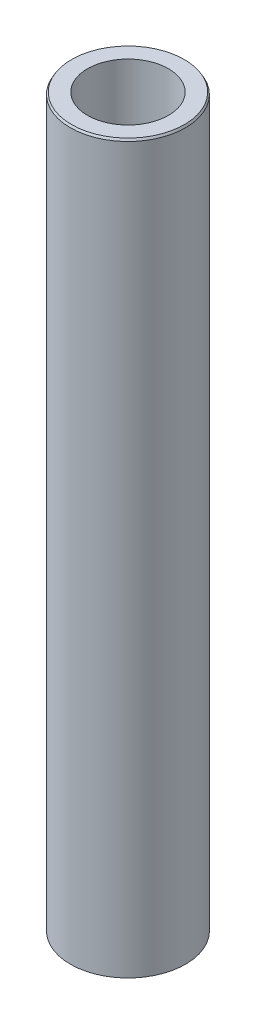
from build123d import *
from OCP.BRepFilletAPI import BRepFilletAPI_MakeChamfer

# Parameters (mm, degrees)
SKETCH1_R           = 47.5
BOSS_EXTRUDE1_DEPTH = 600
SKETCH2_R           = 33.361640255
CUT_EXTRUDE1_DEPTH  = 604.748706003
CHAMFER1_SIZE       = 1.738535662
CHAMFER1_SIZE2      = 1.003744033


with BuildPart() as part:
    # Sketch1 → Boss-Extrude1 (new body)
    with BuildSketch(Plane(origin=(0, 0, 0), x_dir=(1, 0, 0), z_dir=(0, 1, 0))):
        Circle(SKETCH1_R)
    extrude(amount=BOSS_EXTRUDE1_DEPTH)

    # Sketch2 → Cut-Extrude1 (cut, through all)
    with BuildSketch(Plane(origin=(0, 0, 0), x_dir=(1, 0, 0), z_dir=(0, 1, 0))):
        Circle(SKETCH2_R)
    extrude(amount=CUT_EXTRUDE1_DEPTH, mode=Mode.SUBTRACT)

    # Chamfer1: one chamfer whose edges measure the first distance from different faces: ONE call of the kernel's chamfer builder (chamfer() names one face for all edges)
    chamfer1_edges_1 = [part.edges().sort_by_distance(p)[0] for p in [
        (-47.5, 600, 0),
    ]]
    chamfer1_side_1 = [part.faces().sort_by_distance(p)[0] for p in [
        (-47.5, 300, 0),
    ]]
    chamfer1_edges_2 = [part.edges().sort_by_distance(p)[0] for p in [
        (-47.5, 0, 0),
    ]]
    chamfer1_side_2 = [part.faces().sort_by_distance(p)[0] for p in [
        (-46.156497116, 0, 0),
    ]]
    chamfer1 = BRepFilletAPI_MakeChamfer(part.part.solid().wrapped)
    for e in chamfer1_edges_1:
        chamfer1.Add(CHAMFER1_SIZE, CHAMFER1_SIZE2, e.wrapped, chamfer1_side_1[0].wrapped)  # the first distance lies on this face
    for e in chamfer1_edges_2:
        chamfer1.Add(CHAMFER1_SIZE, CHAMFER1_SIZE2, e.wrapped, chamfer1_side_2[0].wrapped)  # the first distance lies on this face
    add(Compound.cast(chamfer1.Shape()), mode=Mode.REPLACE)


solid = part.part
